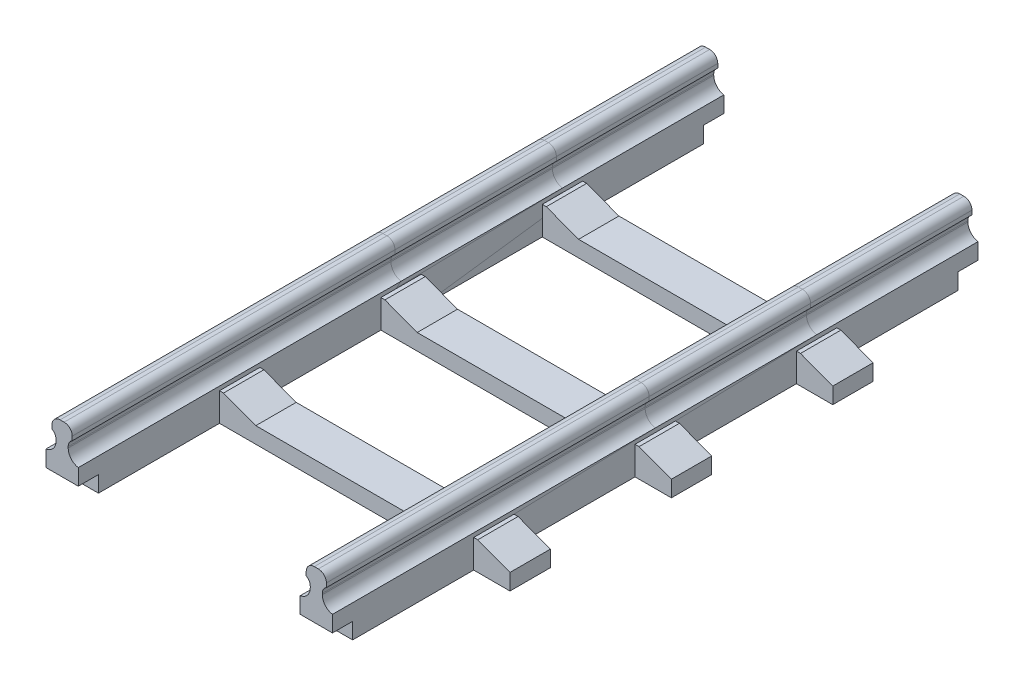
from build123d import *

# Parameters (mm, degrees)
SKETCH_1_W             = 4
SKETCH_1_H             = 17.5
SKETCH_1_H_2           = 5
EXTRUDE_1_DEPTH        = 4
SKETCH_1_7_W           = 44.5
SKETCH_1_7_H           = 5
EXTRUDE_2_DEPTH        = 3.5
SKETCH_2_W             = 18.5
SKETCH_2_H             = 1.5
CUT_EXTRUDE_1_DEPTH    = 32.89533665
SKETCH_2_3_W           = 2.5
SKETCH_2_3_H           = 1.5
EXTRUDE_4_DEPTH        = 22.5
FILLET_1_R             = 1
FILLET_2_R             = 1.5
FILLET_3_R             = 1
SKETCH_5_W             = 2.5
SKETCH_5_H             = 2
CUT_EXTRUDE_2_DEPTH    = 43.315038698
SKETCH_10_R            = 0.4
CUT_EXTRUDE_3_DEPTH    = 2
PATTERN_LINEAR_2_COUNT = 3
PATTERN_LINEAR_2_PITCH = 20


with BuildPart() as part:
    # 草图1 → 凸台-拉伸1 (new body)
    with BuildSketch(Plane(origin=(0, 0, 0), x_dir=(1, 0, 0), z_dir=(0, 1, 0))):
        with Locations((-15.75, -2.5)):
            Rectangle(SKETCH_1_W, SKETCH_1_H)
        with Locations((15.75, -2.5)):
            Rectangle(SKETCH_1_W, SKETCH_1_H)
        with Locations((15.75, 8.75)):
            Rectangle(SKETCH_1_W, SKETCH_1_H_2)
        with Locations((-15.75, 8.75)):
            Rectangle(SKETCH_1_W, SKETCH_1_H_2)
    extrude(amount=EXTRUDE_1_DEPTH)

    # 草图1<7> → 凸台-拉伸2 (add)
    with BuildSketch(Plane(origin=(0, 0, 0), x_dir=(1, 0, 0), z_dir=(0, 1, 0))):
        with Locations((0, 8.75)):
            Rectangle(SKETCH_1_7_W, SKETCH_1_7_H)
    extrude(amount=EXTRUDE_2_DEPTH)

    # 草图2 → 切除-拉伸1 (cut, through all)
    with BuildSketch(Plane(origin=(0, 0, -11.25), x_dir=(-1, 0, 0), z_dir=(0, 0, -1))):
        with Locations((0, 2.75)):
            Rectangle(SKETCH_2_W, SKETCH_2_H)
        Polygon((13.25, 3.5), (9.25, 3.5), (9.25, 2), align=None)
        Polygon((-9.25, 3.5), (-13.25, 3.5), (-9.25, 2), align=None)
        Polygon((-22.25, 3.5), (-22.25, 2), (-18.25, 3.5), align=None)
        Polygon((22.25, 3.5), (18.25, 3.5), (22.25, 2), align=None)
    extrude(amount=-CUT_EXTRUDE_1_DEPTH, mode=Mode.SUBTRACT)

    # 草图2<3> → 凸台-拉伸4 (add, through all)
    with BuildSketch(Plane(origin=(0, 0, -11.25), x_dir=(-1, 0, 0), z_dir=(0, 0, -1))):
        with Locations((-15.75, 7.25)):
            Rectangle(SKETCH_2_3_W, SKETCH_2_3_H)
        Polygon((-15, 6.5), (-16.5, 6.5), (-16.5, 4), (-15.75, 4), (-15, 4), align=None)
        with Locations((15.75, 7.25)):
            Rectangle(SKETCH_2_3_W, SKETCH_2_3_H)
        Polygon((16.5, 6.5), (15, 6.5), (15, 4), (15.75, 4), (16.5, 4), align=None)
    extrude(amount=-EXTRUDE_4_DEPTH)

    # 圆角1
    # the kernel refuses this fillet: 1 mm, written as the material it adds along each edge
    with BuildSketch(Plane(origin=(-16.5, 6.5, -11.25), x_dir=(0, -1, 0), z_dir=(0, 0, 1))) as fillet_1_piece_1:
        with BuildLine():
            CenterArc((0.866025404, -1), FILLET_1_R, 90, 60)
            Line((0, -0.5), (-0.017320508, -0.49))
            ThreePointArc((-0.017320508, -0.49), (-0.02, -0.25), (-0.02, 0))
            Line((-0.02, 0), (0, 0.02))
            Line((0, 0.02), (0.866025404, 0.02))
            Line((0.866025404, 0.02), (0.866025404, 0))
        make_face()
    extrude(amount=22.5)
    with BuildSketch(Plane(origin=(-15, 6.5, -11.25), x_dir=(0, -1, 0), z_dir=(0, 0, 1)), Plane(origin=(16.5, 6.5, -11.25), x_dir=(0, -1, 0), z_dir=(0, 0, 1))) as fillet_1_piece_2:
        with BuildLine():
            CenterArc((0.866025404, 1), FILLET_1_R, 210, 60)
            Line((0, 0.5), (-0.017320508, 0.49))
            ThreePointArc((-0.017320508, 0.49), (-0.02, 0.25), (-0.02, 0))
            Line((-0.02, 0), (0, -0.02))
            Line((0, -0.02), (0.866025404, -0.02))
            Line((0.866025404, -0.02), (0.866025404, 0))
        make_face()
    extrude(amount=22.5)
    with BuildSketch(Plane(origin=(15, 6.5, -11.25), x_dir=(-1, 0, 0), z_dir=(0, 0, 1))) as fillet_1_piece_3:
        with BuildLine():
            CenterArc((1, 0.866025404), FILLET_1_R, 180, 60)
            Line((0, 0.866025404), (-0.02, 0.866025404))
            Line((-0.02, 0.866025404), (-0.02, 0))
            Line((-0.02, 0), (0, -0.02))
            ThreePointArc((0, -0.02), (0.25, -0.02), (0.49, -0.017320508))
            Line((0.49, -0.017320508), (0.5, 0))
        make_face()
    extrude(amount=22.5)

    # 圆角2
    # the kernel refuses this fillet: 1.5 mm, written as the material it adds along each edge
    with BuildSketch(Plane(origin=(16.5, 4, -11.25), x_dir=(1, 0, 0), z_dir=(0, 0, 1)), Plane(origin=(-15, 4, -11.25), x_dir=(1, 0, 0), z_dir=(0, 0, 1))) as fillet_2_piece_1:
        with BuildLine():
            CenterArc((1.5, 1.479019946), FILLET_2_R, 180, 80.405931773)
            Line((0, 1.479019946), (-0.03, 1.479019946))
            Line((-0.03, 1.479019946), (-0.03, 0))
            Line((-0.03, 0), (0, -0.03))
            ThreePointArc((0, -0.03), (0.625, -0.03), (1.245, -0.029580399))
            Line((1.245, -0.029580399), (1.25, 0))
        make_face()
    extrude(amount=22.5)
    with BuildSketch(Plane(origin=(15, 4, -11.25), x_dir=(0, 1, 0), z_dir=(0, 0, 1)), Plane(origin=(-16.5, 4, -11.25), x_dir=(0, 1, 0), z_dir=(0, 0, 1))) as fillet_2_piece_2:
        with BuildLine():
            CenterArc((1.479019946, 1.5), FILLET_2_R, 189.594068227, 80.405931773)
            Line((0, 1.25), (-0.029580399, 1.245))
            ThreePointArc((-0.029580399, 1.245), (-0.03, 0.625), (-0.03, 0))
            Line((-0.03, 0), (0, -0.03))
            Line((0, -0.03), (1.479019946, -0.03))
            Line((1.479019946, -0.03), (1.479019946, 0))
        make_face()
    extrude(amount=22.5)

    # 圆角3
    fillet_3_edges = [part.edges().sort_by_distance(p)[0] for p in [
        (14.5, 8, 0),
        (17, 8, 0),
        (-17, 8, 0),
        (-14.5, 8, 0),
    ]]
    fillet(fillet_3_edges, radius=FILLET_3_R)

    # 草图5 → 切除-拉伸2 (cut, through all)
    with BuildSketch(Plane(origin=(17.75, 0, 0), x_dir=(0, 0, -1), z_dir=(1, 0, 0))):
        with Locations((-10, 1)):
            Rectangle(SKETCH_5_W, SKETCH_5_H)
    extrude(amount=-CUT_EXTRUDE_2_DEPTH, mode=Mode.SUBTRACT)

    # 草图10 → 切除-拉伸3 (cut)
    with BuildSketch(Plane.XZ.offset(-2)):
        with Locations(Location((15.75, 10, 0), (0, 0, 270))):
            Circle(SKETCH_10_R)
        with Locations(Location((-15.75, 10, 0), (0, 0, 270))):
            Circle(SKETCH_10_R)
    extrude(amount=-CUT_EXTRUDE_3_DEPTH, mode=Mode.SUBTRACT)

    # 镜向1: part across plane


with BuildPart() as part_1:
    add(part.part)
    add(part.part.mirror(Plane(origin=(0, 0, -8.75), x_dir=(1, 0, 0), z_dir=(0, 0, -1))))


with BuildPart() as pattern_linear_2_1:
    # 阵列(线性)2: pattern copy
    add(part_1.part.moved(Location(Vector(0, 0, -1) * (1 * PATTERN_LINEAR_2_PITCH))))


with BuildPart() as pattern_linear_2_2:
    # 阵列(线性)2: pattern copy
    add(part_1.part.moved(Location(Vector(0, 0, -1) * (2 * PATTERN_LINEAR_2_PITCH))))


solid = Compound([part_1.part, pattern_linear_2_1.part, pattern_linear_2_2.part])
